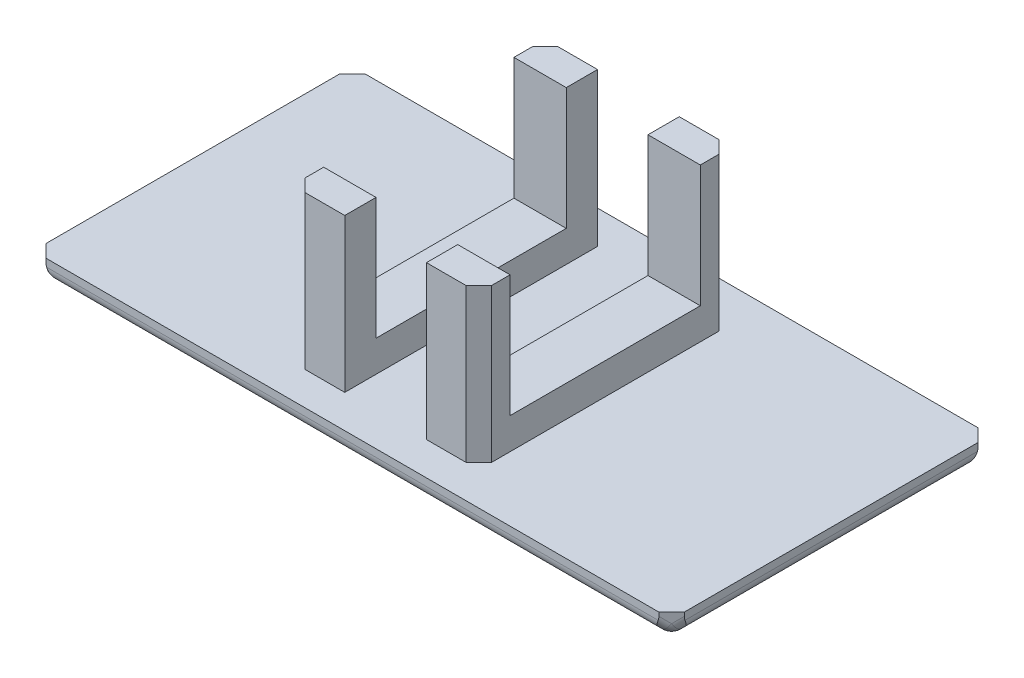
from build123d import *

# Parameters (mm, degrees)
SKETCH1_W           = 50
SKETCH1_H           = 25
BOSS_EXTRUDE1_DEPTH = 3
SKETCH2_W           = 4.1
SKETCH2_H           = 19.8
BOSS_EXTRUDE2_DEPTH = 12
CHAMFER3_SIZE       = 1
CHAMFER1_SIZE       = 2
FILLET1_R           = 1
SKETCH3_W           = 7.45
SKETCH3_H           = 9.55
CUT_EXTRUDE1_DEPTH  = 38.743078836
CHAMFER2_SIZE       = 1


with BuildPart() as part:
    # Sketch1 → Boss-Extrude1 (new body)
    with BuildSketch(Plane(origin=(0, 0, 0), x_dir=(1, 0, 0), z_dir=(0, 1, 0))):
        Rectangle(SKETCH1_W, SKETCH1_H)
    extrude(amount=BOSS_EXTRUDE1_DEPTH)

    # Sketch2 → Boss-Extrude2 (add)
    with BuildSketch(Plane(origin=(0, 3, 0), x_dir=(1, 0, 0), z_dir=(0, 1, 0))):
        with Locations((-5.25, 0)):
            Rectangle(SKETCH2_W, SKETCH2_H)
        with Locations((5.25, 0)):
            Rectangle(SKETCH2_W, SKETCH2_H)
    extrude(amount=BOSS_EXTRUDE2_DEPTH)

    # Chamfer3
    chamfer3_edges = [part.edges().sort_by_distance(p)[0] for p in [
        (25, 1.5, 12.5),
        (-25, 1.5, 12.5),
        (-25, 1.5, -12.5),
        (25, 1.5, -12.5),
    ]]
    chamfer(chamfer3_edges, length=CHAMFER3_SIZE)

    # Chamfer1
    # the kernel refuses this chamfer: 2 mm, written as the material it takes off along each edge
    with BuildSketch(Plane(origin=(-29.143365976, 0, -12.5), x_dir=(0, 0.9996219169112968, -0.027495876610586494), z_dir=(1, 0, 0))) as chamfer1_piece_1:
        Polygon((CHAMFER1_SIZE * 0.999621916911, CHAMFER1_SIZE * 0.0274958766106), (-CHAMFER1_SIZE * 0.0274958766106, CHAMFER1_SIZE * 0.999621916911), (0, 0), align=None)
    extrude(amount=58.286731952, mode=Mode.SUBTRACT)
    with BuildSketch(Plane(origin=(-25, 0, 16.643365976), x_dir=(0.9996219169112968, -0.02749587661058639, 0), z_dir=(0, 0, -1)), Plane(origin=(25, 0, -16.643365976), x_dir=(-0.9996219169112968, -0.02749587661058639, 0), z_dir=(0, 0, 1))) as chamfer1_piece_2:
        Polygon((CHAMFER1_SIZE * 0.999621916911, -CHAMFER1_SIZE * 0.0274958766106), (-CHAMFER1_SIZE * 0.0274958766106, -CHAMFER1_SIZE * 0.999621916911), (0, 0), align=None)
    extrude(amount=33.286731952, mode=Mode.SUBTRACT)
    with BuildSketch(Plane(origin=(29.143365976, 0, 12.5), x_dir=(0, -0.027495876610586365, -0.9996219169112968), z_dir=(-1, 0, 0))) as chamfer1_piece_3:
        Polygon((CHAMFER1_SIZE * 0.999621916911, -CHAMFER1_SIZE * 0.0274958766106), (-CHAMFER1_SIZE * 0.0274958766106, -CHAMFER1_SIZE * 0.999621916911), (0, 0), align=None)
    extrude(amount=58.286731952, mode=Mode.SUBTRACT)

    # Fillet1
    fillet1_edges = [part.edges().sort_by_distance(p)[0] for p in [
        (0, 2, -12.5),
        (-24.75, 1.75, -11.75),
        (-24.25, 1.75, -12.25),
        (23, 0, 0),
        (0, 0, 10.5),
        (-23, 0, 0),
        (0, 0, -10.5),
        (24.75, 1.75, -11.75),
        (24.25, 1.75, -12.25),
        (-25, 2, 0),
        (-24.25, 1.75, 12.25),
        (-24.75, 1.75, 11.75),
        (0, 2, 12.5),
        (24.75, 1.75, 11.75),
        (24.25, 1.75, 12.25),
        (25, 2, 0),
        (23.75, 0.75, 11.25),
        (-23.75, 0.75, 11.25),
        (23.75, 0.75, -11.25),
        (-23.75, 0.75, -11.25),
    ]]
    fillet(fillet1_edges, radius=FILLET1_R)

    # Sketch3 → Cut-Extrude1 (cut, through all)
    with BuildSketch(Plane.ZY.offset(7.3)):
        with Locations((-3.725, 10.225)):
            Rectangle(SKETCH3_W, SKETCH3_H)
        with Locations((3.725, 10.225)):
            Rectangle(SKETCH3_W, SKETCH3_H)
    extrude(amount=-CUT_EXTRUDE1_DEPTH, mode=Mode.SUBTRACT)

    # Chamfer2
    chamfer2_edges = [part.edges().sort_by_distance(p)[0] for p in [
        (-7.3, 9, -9.9),
        (-7.3, 9, 9.9),
        (7.3, 9, 9.9),
        (7.3, 9, -9.9),
    ]]
    chamfer(chamfer2_edges, length=CHAMFER2_SIZE)


solid = part.part
